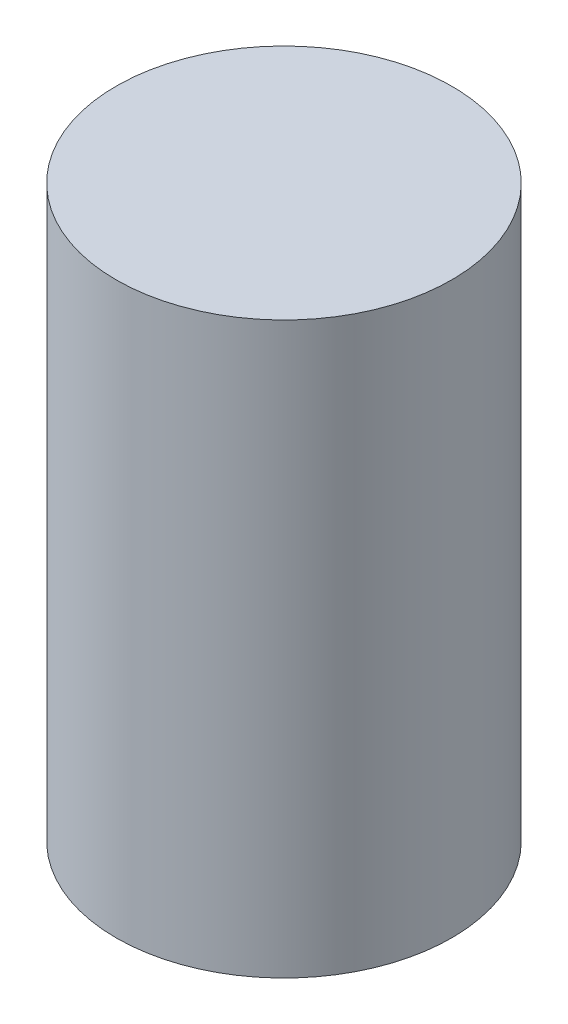
from build123d import *

# Parameters (mm, degrees)
ESQUISSE1_R        = 73.61
BOSS_EXTRU_1_DEPTH = 250


with BuildPart() as part:
    # Esquisse1 → Boss.-Extru.1 (new body)
    with BuildSketch(Plane(origin=(0, 0, 0), x_dir=(1, 0, 0), z_dir=(0, 1, 0))):
        Circle(ESQUISSE1_R)
    extrude(amount=BOSS_EXTRU_1_DEPTH)


solid = part.part
